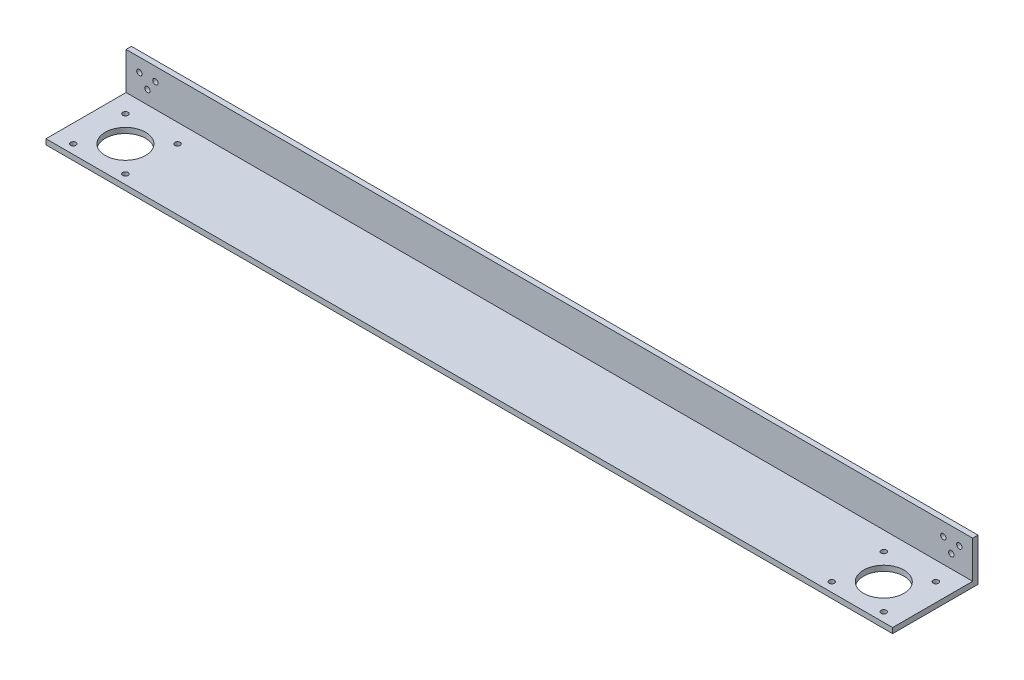
from build123d import *

# Parameters (mm, degrees)
BOSS_EXTRUDE1_DEPTH              = 503.65
TOPHOLES_SKETCH2_R               = 12
TOPHOLES_SKETCH2_R_2             = 1.5875
TOPHOLES_CUT_EXTRUDE1_DEPTH      = 507.693115332
BACKSIDEHOLES_SKETCH3_R          = 1.5875
BACKSIDEHOLES_CUT_EXTRUDE2_DEPTH = 507.842305357


with BuildPart() as part:
    # Sketch1 → Boss-Extrude1 (new body)
    with BuildSketch(Plane(origin=(0, 0, 0), x_dir=(0, 0, -1), z_dir=(1, 0, 0))):
        Polygon((0, 0), (-50.8, 0), (-50.8, 3.175), (-3.175, 3.175), (-3.175, 25.4), (0, 25.4), align=None)
    extrude(amount=BOSS_EXTRUDE1_DEPTH)

    # TopHoles-Sketch2 → TopHoles-Cut-Extrude1 (cut, through all)
    with BuildSketch(Plane(origin=(0, 3.175, 0), x_dir=(1, 0, 0), z_dir=(0, 1, 0))):
        with Locations((26.25, -29.8)):
            Circle(TOPHOLES_SKETCH2_R)
        with Locations((477.4, -29.8)):
            Circle(TOPHOLES_SKETCH2_R)
        with Locations((10.75, -14.3)):
            Circle(TOPHOLES_SKETCH2_R_2)
        with Locations((41.75, -14.3)):
            Circle(TOPHOLES_SKETCH2_R_2)
        with Locations((461.9, -14.3)):
            Circle(TOPHOLES_SKETCH2_R_2)
        with Locations((492.9, -14.3)):
            Circle(TOPHOLES_SKETCH2_R_2)
        with Locations((10.75, -45.3)):
            Circle(TOPHOLES_SKETCH2_R_2)
        with Locations((41.75, -45.3)):
            Circle(TOPHOLES_SKETCH2_R_2)
        with Locations((461.9, -45.3)):
            Circle(TOPHOLES_SKETCH2_R_2)
        with Locations((492.9, -45.3)):
            Circle(TOPHOLES_SKETCH2_R_2)
    extrude(amount=-TOPHOLES_CUT_EXTRUDE1_DEPTH, mode=Mode.SUBTRACT)

    # BackSideHoles-Sketch3 → BackSideHoles-Cut-Extrude2 (cut, through all)
    with BuildSketch(Plane(origin=(0, 0, 0), x_dir=(-1, 0, 0), z_dir=(0, 0, -1))):
        with Locations((-495.7125, 17.4625)):
            Circle(BACKSIDEHOLES_SKETCH3_R)
        with Locations((-486.1875, 17.4625)):
            Circle(BACKSIDEHOLES_SKETCH3_R)
        with Locations((-490.95, 11.1125)):
            Circle(BACKSIDEHOLES_SKETCH3_R)
        with Locations((-12.7, 11.1125)):
            Circle(BACKSIDEHOLES_SKETCH3_R)
        with Locations((-17.4625, 17.4625)):
            Circle(BACKSIDEHOLES_SKETCH3_R)
        with Locations((-7.9375, 17.4625)):
            Circle(BACKSIDEHOLES_SKETCH3_R)
    extrude(amount=-BACKSIDEHOLES_CUT_EXTRUDE2_DEPTH, mode=Mode.SUBTRACT)


solid = part.part
